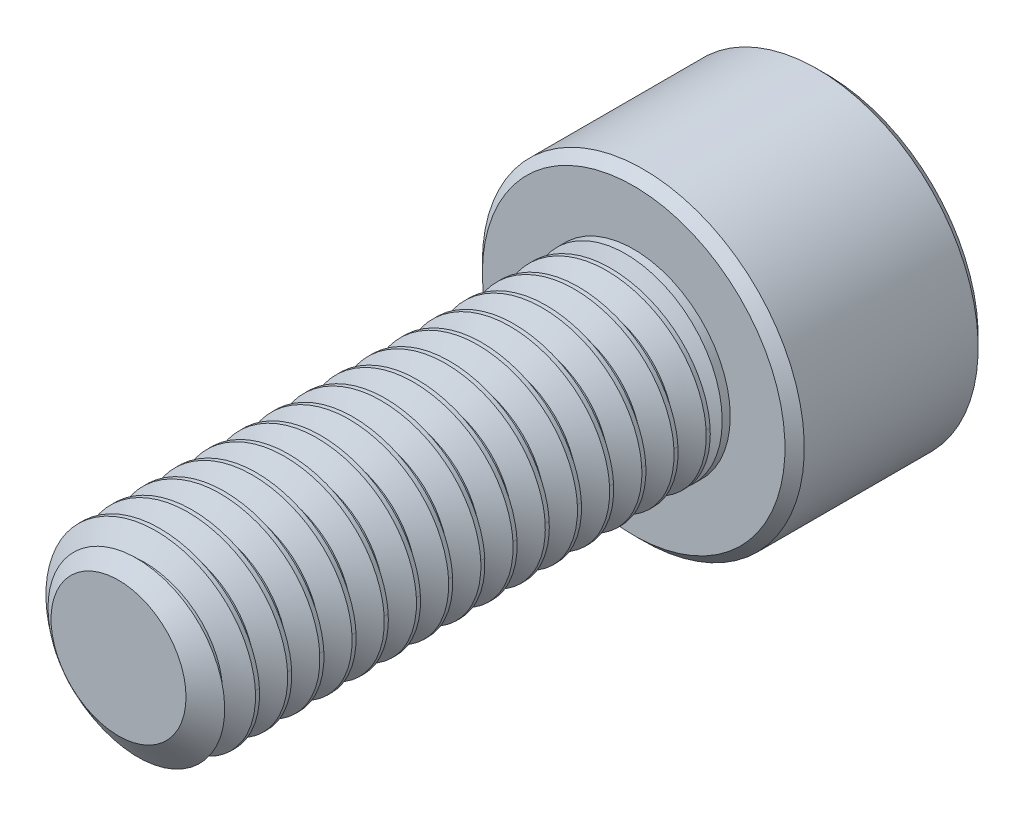
from build123d import *

# Parameters (mm, degrees)
SKETCH1_R          = 3
EXTRUDE1_DEPTH     = 16
CUT_SWEEP1_PITCH   = 1
SKETCH6_R          = 5
EXTRUDE2_DEPTH     = 6
CUT_EXTRUDE1_DEPTH = 3.75
CHAMFER1_SIZE      = 0.3


with BuildPart() as part:
    # Sketch1 → Extrude1 (new body)
    with BuildSketch(Plane.XY):
        Circle(SKETCH1_R)
    extrude(amount=-EXTRUDE1_DEPTH)

    # Cut-Sweep1: the profile of Sketch3 profile screwed along a right-hand helix of 17 turns, 6 arcs to a turn; built about Z, then put on its axis
    cut_sweep1_z = Axis((0, 0, 0), (0, 0, 1))
    cut_sweep1_corners = [(3.0003, 0, -0.875173205), (2.350480947, 0, -0.5), (2.350480947, 0, -0.375), (3.0003, 0, 0.000173205)]
    with BuildLine(mode=Mode.PRIVATE) as cut_sweep1_profile:
        Line(cut_sweep1_corners[0], cut_sweep1_corners[1])
        Line(cut_sweep1_corners[1], cut_sweep1_corners[2])
        Line(cut_sweep1_corners[2], cut_sweep1_corners[3])
        Line(cut_sweep1_corners[3], cut_sweep1_corners[0])
    cut_sweep1_cap = Face(cut_sweep1_profile.wire())
    cut_sweep1_turn_angles = [0, 30, 60, 90, 120, 150, 180, 210, 240, 270, 300, 330, 360]
    cut_sweep1_turn_weights = [1, 0.8660254037844387, 1, 0.8660254037844387, 1, 0.8660254037844387, 1, 0.8660254037844387, 1, 0.8660254037844387, 1, 0.8660254037844387, 1]
    cut_sweep1_turn_rails = [Edge.make_bspline([Vector(p[0], p[1], 0).rotate(cut_sweep1_z, cut_sweep1_turn_angles[k]) / cut_sweep1_turn_weights[k] + Vector(0, 0, p[2] + CUT_SWEEP1_PITCH * cut_sweep1_turn_angles[k] / 360) for k in range(13)], [0, 0, 0, 1, 1, 2, 2, 3, 3, 4, 4, 5, 5, 6, 6, 6], 2, cut_sweep1_turn_weights) for p in cut_sweep1_corners]
    cut_sweep1_turn_sides = [Face.make_surface_from_curves(cut_sweep1_turn_rails[p[0]], cut_sweep1_turn_rails[p[1]]) for p in [(0, 1), (1, 2), (2, 3), (3, 0)]]
    cut_sweep1 = Plane(origin=(0, 0, 0), x_dir=(0, 1, 0), z_dir=(0, 0, -1)) * Solid(Shell([*[p.moved(Location((0, 0, CUT_SWEEP1_PITCH * i))) for i in range(17) for p in cut_sweep1_turn_sides], cut_sweep1_cap, cut_sweep1_cap.rotate(cut_sweep1_z, 6120).moved(Location((0, 0, CUT_SWEEP1_PITCH * 6120 / 360)))]))
    add(cut_sweep1, mode=Mode.SUBTRACT)

    # Sketch4 → Cut-Revolve1 (revolve, cut)
    with BuildSketch(Plane(origin=(0, 0, 0), x_dir=(0, 0, -1), z_dir=(1, 0, 0)), mode=Mode.PRIVATE) as cut_revolve1_sk:
        Polygon((0.632650852, 3), (0, 2.096480947), (0, 3), align=None)
    revolve(cut_revolve1_sk.sketch.rotate(Axis((0, 0, 0), (0, 0, -1)), 90), axis=Axis((0, 0, 0), (0, 0, -1)), mode=Mode.SUBTRACT)

    # Sketch6 → Extrude2 (add)
    with BuildSketch(Plane(origin=(0, 0, -16), x_dir=(-1, 0, 0), z_dir=(0, 0, -1))):
        Circle(SKETCH6_R)
    extrude(amount=EXTRUDE2_DEPTH)

    # Sketch7 → Cut-Extrude1 (cut)
    with BuildSketch(Plane(origin=(0, 0, -22), x_dir=(-1, 0, 0), z_dir=(0, 0, -1))):
        Polygon((0, 2.886751346), (-2.5, 1.443375673), (-2.5, -1.443375673), (0, -2.886751346), (2.5, -1.443375673), (2.5, 1.443375673), align=None)
    extrude(amount=-CUT_EXTRUDE1_DEPTH, mode=Mode.SUBTRACT)

    # Cut-Extrude2 cone 1 section (through the dimple's axis) → Cut-Extrude2 (revolve, cut)
    with BuildSketch(Plane(origin=(0, 0, -22), x_dir=(0, 1, 0), z_dir=(1, 0, 0))):
        Polygon((0, 0), (2.886751346, 0), (0, 2.886751346), align=None)
    revolve(axis=Axis((0, 0, -22), (0, 0, 1)), mode=Mode.SUBTRACT)

    # Chamfer1
    chamfer1_edges = [part.edges().sort_by_distance(p)[0] for p in [
        (5, 0, -16),
        (5, 0, -22),
    ]]
    chamfer(chamfer1_edges, length=CHAMFER1_SIZE)

    # Sketch10 → Revolve1 (revolve)
    with BuildSketch(Plane(origin=(0, 0, 0), x_dir=(0, 0, -1), z_dir=(1, 0, 0)), mode=Mode.PRIVATE) as revolve1_sk:
        Polygon((16, 3), (16, 0), (14.507359313, 0), (15.75, 3), align=None)
    revolve(revolve1_sk.sketch.rotate(Axis((0, 0, -16), (0, 0, 1)), 270), axis=Axis((0, 0, -16), (0, 0, 1)))


solid = part.part
